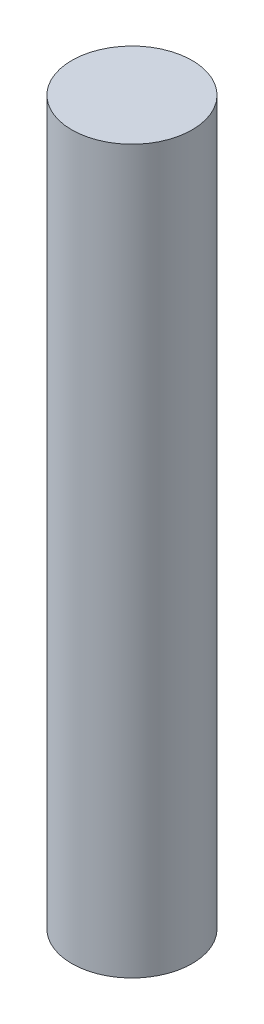
from build123d import *

# Parameters (mm, degrees)
SKETCH1_R           = 25
BOSS_EXTRUDE1_DEPTH = 300


with BuildPart() as part:
    # Sketch1 → Boss-Extrude1 (new body)
    with BuildSketch(Plane(origin=(0, -69, 0), x_dir=(1, 0, 0), z_dir=(0, 1, 0))):
        Circle(SKETCH1_R)
    extrude(amount=-BOSS_EXTRUDE1_DEPTH)


solid = part.part
